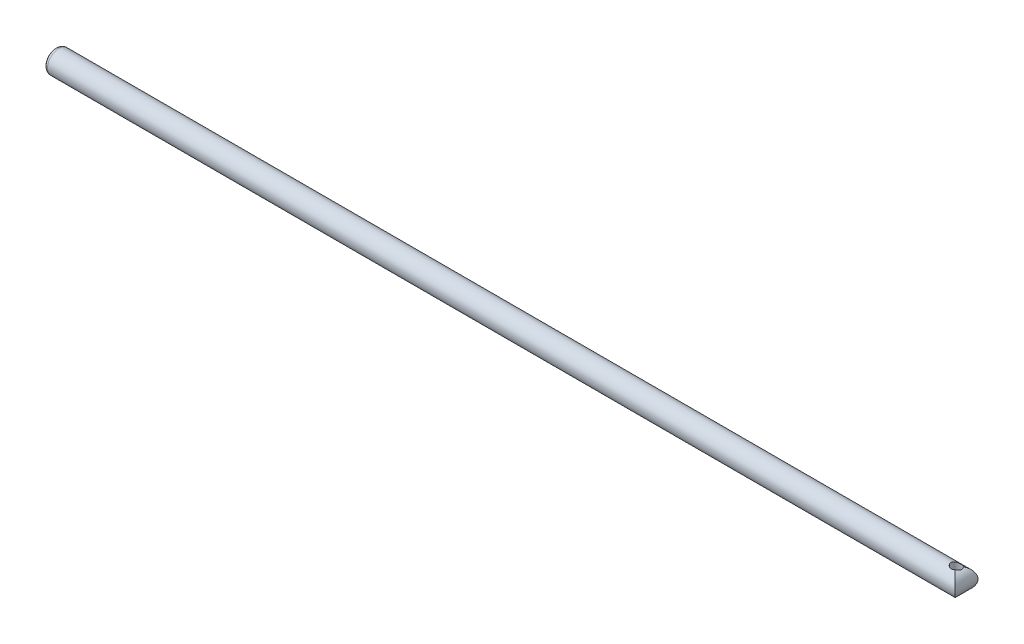
from build123d import *

# Parameters (mm, degrees)
SKETCH1_R               = 2.25
BOSS_EXTRUDE1_DEPTH     = 180
FILLET1_R               = 0.75
CUT_EXTRUDE1_DEPTH      = 181.028122803
CUT_EXTRUDE1_DEPTH_BACK = 181.028122803
CAVITY1_OUTLINE_W       = 1
CAVITY1_OUTLINE_H       = 4.503251691


# Read off the part's stored shape, not the designer's step: Cavity1
with BuildPart() as part:
    # Sketch1 → Boss-Extrude1 (new body)
    with BuildSketch(Plane(origin=(0, 0, 0), x_dir=(0, 0, -1), z_dir=(1, 0, 0))):
        with Locations(Location((0, 0, 0), (0, 0, 180))):
            Circle(SKETCH1_R)
    extrude(amount=BOSS_EXTRUDE1_DEPTH)

    # Fillet1
    fillet1_edges = [part.edges().sort_by_distance(p)[0] for p in [
        (0, 0, -2.25),
    ]]
    fillet(fillet1_edges, radius=FILLET1_R)

    # Sketch2 → Cut-Extrude1 (cut, two sides: drawn at the far end of the back side and taken through both)
    with BuildSketch(Plane.XY.offset(-CUT_EXTRUDE1_DEPTH_BACK)):
        with BuildLine():
            Line((180, 2.25), (177.75, 2.25))
            ThreePointArc((177.75, 2.25), (179.340990258, 1.590990258), (180, 0))
            Line((180, 0), (180, 2.25))
        make_face()
        with BuildLine():
            Line((180, -2.25), (180, 0))
            ThreePointArc((180, 0), (179.340990258, -1.590990258), (177.75, -2.25))
            Line((177.75, -2.25), (180, -2.25))
        make_face()
    extrude(amount=CUT_EXTRUDE1_DEPTH + CUT_EXTRUDE1_DEPTH_BACK, mode=Mode.SUBTRACT)

    # Cavity1 outline → Cavity1 (revolve, cut)
    with BuildSketch(Plane(origin=(177.75, -0.001139824, -0.214423248), x_dir=(1, 0, 0), z_dir=(0, 0.005315692237830849, 0.9999858716082107))):
        with Locations((0.5, 0.001514697)):
            Rectangle(CAVITY1_OUTLINE_W, CAVITY1_OUTLINE_H)
    revolve(axis=Axis((177.75, -0.001139824, -0.214423248), (0, 0.9999858716082107, -0.005315692237830849)), mode=Mode.SUBTRACT)


solid = part.part
